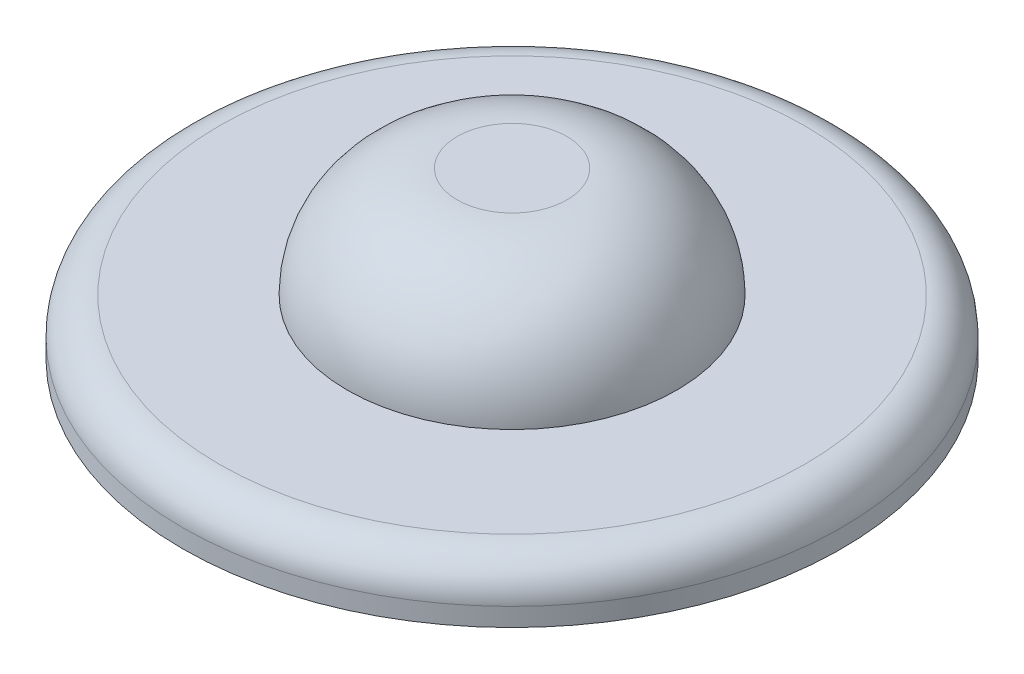
from build123d import *

# Parameters (mm, degrees)
SKETCH1_R           = 60
BOSS_EXTRUDE1_DEPTH = 10
SKETCH2_R           = 90
BOSS_EXTRUDE2_DEPTH = 15
SKETCH3_R           = 45
BOSS_EXTRUDE3_DEPTH = 30
FILLET1_R           = 10
FILLET2_R           = 30


with BuildPart() as part:
    # Sketch1 → Boss-Extrude1 (new body)
    with BuildSketch(Plane(origin=(0, 0, 0), x_dir=(1, 0, 0), z_dir=(0, 1, 0))):
        with Locations(Location((0, 0, 0), (0, 0, 270))):
            Circle(SKETCH1_R)
    extrude(amount=BOSS_EXTRUDE1_DEPTH)

    # Sketch2 → Boss-Extrude2 (add)
    with BuildSketch(Plane(origin=(0, 10, 0), x_dir=(1, 0, 0), z_dir=(0, 1, 0))):
        with Locations(Location((0, 0, 0), (0, 0, 270))):
            Circle(SKETCH2_R)
    extrude(amount=BOSS_EXTRUDE2_DEPTH)

    # Sketch3 → Boss-Extrude3 (add)
    with BuildSketch(Plane(origin=(0, 25, 0), x_dir=(1, 0, 0), z_dir=(0, 1, 0))):
        with Locations(Location((0, 0, 0), (0, 0, 270))):
            Circle(SKETCH3_R)
    extrude(amount=BOSS_EXTRUDE3_DEPTH)

    # Fillet1
    fillet1_edges = [part.edges().sort_by_distance(p)[0] for p in [
        (0, 25, -90),
    ]]
    fillet(fillet1_edges, radius=FILLET1_R)

    # Fillet2
    fillet2_edges = [part.edges().sort_by_distance(p)[0] for p in [
        (0, 55, -45),
    ]]
    fillet(fillet2_edges, radius=FILLET2_R - 0.0001)  # a hair under: the kernel refuses the full size


solid = part.part
